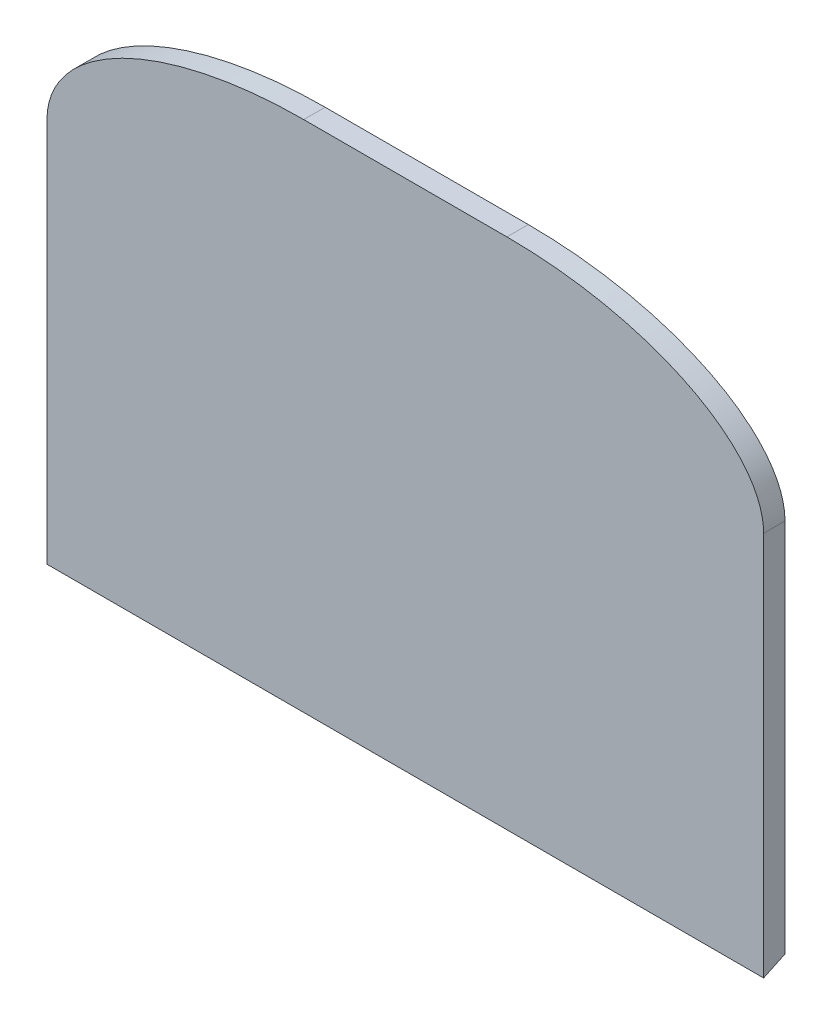
from build123d import *

# Parameters (mm, degrees)
BOSS_EXTRUDE1_DEPTH      = 212.7
BOSS_EXTRUDE1_DEPTH_BACK = 212.7
FILLET1_SIZE             = 76.2
FILLET1_SIZE_2           = 152.4


with BuildPart() as part:
    # Sketch2 → Boss-Extrude1 (new, two sides: drawn at the far end of the back side and taken through both)
    with BuildSketch(Plane(origin=(0, 0, 0), x_dir=(0, 0, -1), z_dir=(1, 0, 0)).offset(-BOSS_EXTRUDE1_DEPTH_BACK)):
        Polygon((0, 222.024281539), (0, 520.830449238), (-12.7, 520.830449238), (-12.7, 216.030449238), align=None)
    extrude(amount=BOSS_EXTRUDE1_DEPTH + BOSS_EXTRUDE1_DEPTH_BACK)

    # Fillet1
    # an asymmetric fillet: 152.4, 76.2 mm, written as the material it takes off along each edge
    with BuildSketch(Plane(origin=(-212.7, 520.830449238, -381), x_dir=(0, -1, 0), z_dir=(0, 0, 1))) as fillet1_piece_1:
        with BuildLine():
            Bezier((FILLET1_SIZE, 0), (0, 0), (0, FILLET1_SIZE_2), weights=[1, 0.707106781, 1])
            Line((0, FILLET1_SIZE_2), (0, 0))
            Line((0, 0), (FILLET1_SIZE, 0))
        make_face()
    extrude(amount=774.7, mode=Mode.SUBTRACT)
    with BuildSketch(Plane(origin=(212.7, 520.830449238, -381), x_dir=(-1, 0, 0), z_dir=(0, 0, 1))) as fillet1_piece_2:
        with BuildLine():
            Bezier((FILLET1_SIZE_2, 0), (0, 0), (0, FILLET1_SIZE), weights=[1, 0.707106781, 1])
            Line((0, FILLET1_SIZE), (0, 0))
            Line((0, 0), (FILLET1_SIZE_2, 0))
        make_face()
    extrude(amount=774.7, mode=Mode.SUBTRACT)


solid = part.part
